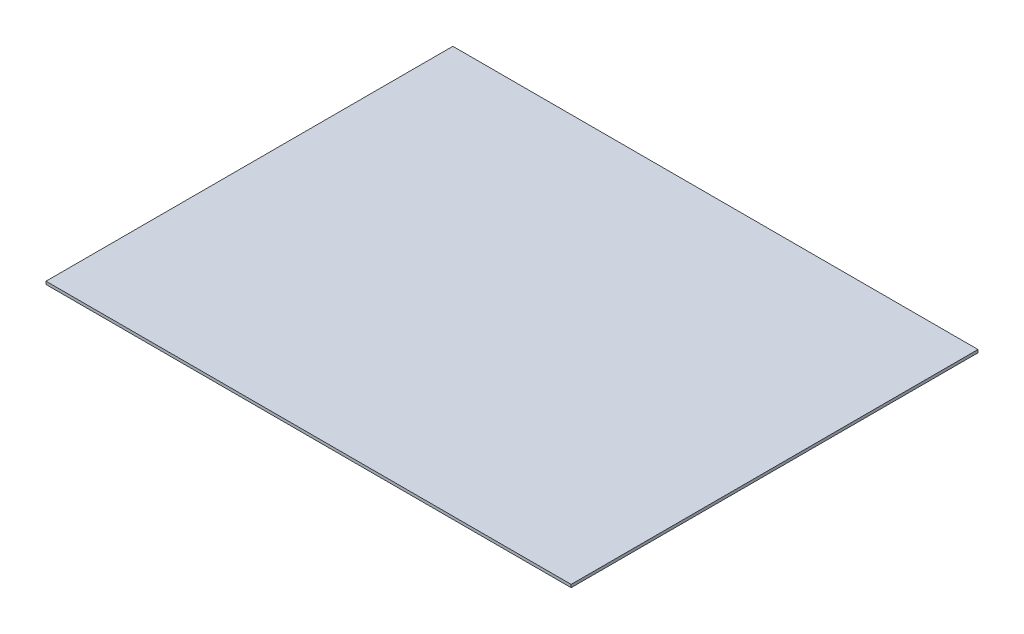
from build123d import *

# Parameters (mm, degrees)
SKETCH1_W           = 182
SKETCH1_H           = 141
BOSS_EXTRUDE1_DEPTH = 1


with BuildPart() as part:
    # Sketch1 → Boss-Extrude1 (new body)
    with BuildSketch(Plane(origin=(0, 0, 0), x_dir=(1, 0, 0), z_dir=(0, 1, 0))):
        Rectangle(SKETCH1_W, SKETCH1_H)
    extrude(amount=BOSS_EXTRUDE1_DEPTH)


solid = part.part
